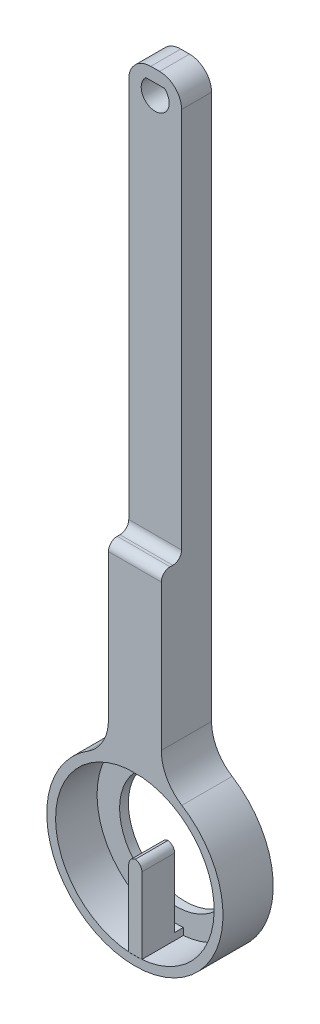
from build123d import *
from build123d.topology import SkipClean

# Parameters (mm, degrees)
BOSS_EXTRUDE1_DEPTH      = 13
BOSS_EXTRUDE1_2_DEPTH    = 13
BOSS_EXTRUDE2_DEPTH      = 13
CUT_EXTRUDE1_DEPTH       = 13
SKETCH3_W                = 6.626848164
SKETCH3_H                = 19.420298156
CUT_EXTRUDE2_DEPTH       = 13
FILLET1_R                = 10
SKETCH4_R                = 20
BOSS_EXTRUDE3_DEPTH      = 13
CUT_EXTRUDE3_DEPTH       = 13
SKETCH6_R                = 18
CUT_EXTRUDE4_DEPTH       = 24
BOSS_EXTRUDE7_DEPTH      = 22
FILLET5_R                = 1.75
FILLET6_R                = 20
SKETCH13_W               = 6.626848164
SKETCH13_H               = 84.326545424
CUT_EXTRUDE8_DEPTH       = 22
FILLET8_R                = 21.5
FILLET9_R                = 21.5
SKETCH14_W               = 17.060891399
SKETCH14_H               = 46.716771418
CUT_EXTRUDE10_DEPTH      = 22
SKETCH23_R               = 16.395826628
CUT_EXTRUDE14_DEPTH      = 4
BOSS_EXTRUDE16_DEPTH     = 2
SKETCH25_R               = 20.128500803
CUT_EXTRUDE15_DEPTH      = 9
SKETCH26_W               = 8.848519257
SKETCH26_H               = 26
CUT_EXTRUDE16_DEPTH      = 9
CUT_EXTRUDE17_DEPTH      = 9
FILLET21_R               = 3.5
SKETCH28_W               = 12
SKETCH28_H               = 42.572003563
BOSS_EXTRUDE20_DEPTH     = 15.8
BOSS_EXTRUDE21_START     = -6.8
SKETCH30_W               = 12
SKETCH30_H               = 93.599870645
BOSS_EXTRUDE21_DEPTH     = 6.8
FILLET23_R               = 5
BOSS_EXTRUDE22_DEPTH     = 6.8
CUT_EXTRUDE18_DEPTH      = 29
CUT_EXTRUDE18_DEPTH_BACK = 41
SKETCH34_W               = 5.585914081
SKETCH34_H               = 80.48337208
FILLET27_R               = 2
FILLET28_R               = 10


with BuildPart() as part:
    # Sketch1 → Boss-Extrude1 (new body)
    with BuildSketch(Plane.XY):
        with BuildLine():
            Line((4, -87.5), (-4, -87.5))
            Line((-4, -87.5), (-4, -67.904082058))
            ThreePointArc((-4, -67.904082058), (0, -107.5), (4, -67.904082058))
            Line((4, -67.904082058), (4, -87.5))
        make_face()
    extrude(amount=BOSS_EXTRUDE1_DEPTH)



with BuildPart() as body_2:
    # Sketch1 → Boss-Extrude1 2 (new body)
    with BuildSketch(Plane.XY):
        with BuildLine():
            Line((-4, 87.5), (-4, -67.904082058))
            ThreePointArc((-4, -67.904082058), (0, -67.5), (4, -67.904082058))
            Line((4, -67.904082058), (4, 87.5))
            ThreePointArc((4, 87.5), (0, 91.5), (-4, 87.5))
        make_face()
    extrude(amount=BOSS_EXTRUDE1_2_DEPTH)


with BuildPart() as part_1:
    add(part.part)

    add(body_2.part)  # Boss-Extrude2 merges body 2
    # Sketch1<3> → Boss-Extrude2 (add)
    with BuildSketch(Plane.XY):
        with BuildLine():
            Line((-4, -67.904082058), (-4, -87.5))
            Line((-4, -87.5), (4, -87.5))
            Line((4, -87.5), (4, -67.904082058))
            ThreePointArc((4, -67.904082058), (0, -67.5), (-4, -67.904082058))
        make_face()
        with BuildLine():
            Line((4, -87.5), (-4, -87.5))
            Line((-4, -87.5), (-4, -67.904082058))
            ThreePointArc((-4, -67.904082058), (-12.649110641, -102.991933385), (20, -87.5))
            ThreePointArc((20, -87.5), (15.491933385, -74.850889359), (4, -67.904082058))
            Line((4, -67.904082058), (4, -87.5))
        make_face()
    extrude(amount=BOSS_EXTRUDE2_DEPTH)

    # Sketch2 → Cut-Extrude1 (cut)
    with BuildSketch(Plane.XY.offset(13)):
        with BuildLine():
            Line((1.836704547, 90.02826846), (-1.836704547, 90.02826846))
            ThreePointArc((-1.836704547, 90.02826846), (-1.418788795, 84.715639507), (3.125, 87.5))
            ThreePointArc((3.125, 87.5), (2.784360493, 88.918788795), (1.836704547, 90.02826846))
        make_face()
    extrude(amount=-CUT_EXTRUDE1_DEPTH, mode=Mode.SUBTRACT)

    # Sketch3 → Cut-Extrude2 (cut)
    with BuildSketch(Plane(origin=(4, 0, 0), x_dir=(0, 0, -1), z_dir=(1, 0, 0))):
        with Locations((-9.686575918, 81.789850922)):
            Rectangle(SKETCH3_W, SKETCH3_H)
    extrude(amount=-CUT_EXTRUDE2_DEPTH, mode=Mode.SUBTRACT)

    # Fillet1
    # the kernel refuses this fillet: 10 mm, written as the material it adds along each edge
    with BuildSketch(Plane(origin=(4, 72.079701844, 6.373151836), x_dir=(0, 1, 0), z_dir=(-1, 0, 0))) as fillet1_piece_1:
        with BuildLine():
            CenterArc((9.413917712, -10), FILLET1_R, 90, 70.286615286)
            Line((0, -6.626848164), (-0.188278354, -6.559385127))
            ThreePointArc((-0.188278354, -6.559385127), (-0.2, -3.313424082), (-0.2, 0))
            Line((-0.2, 0), (0, 0.2))
            Line((0, 0.2), (9.413917712, 0.2))
            Line((9.413917712, 0.2), (9.413917712, 0))
        make_face()
    extrude(amount=8)

    # Sketch4 → Boss-Extrude3 (add)
    with BuildSketch(Plane.XY.offset(13)):
        with Locations(Location((0, -87.5, 0), (0, 0, 101.536959033))):
            Circle(SKETCH4_R)
    extrude(amount=BOSS_EXTRUDE3_DEPTH)

    # Sketch5 → Cut-Extrude3 (cut)
    with BuildSketch(Plane(origin=(4, 0, 0), x_dir=(0, 0, -1), z_dir=(1, 0, 0))):
        with BuildLine():
            Line((-13, 61.057159029), (-13, 87.5))
            Line((-13, 87.5), (-6.373151836, 87.5))
            ThreePointArc((-6.373151836, 87.5), (-7.529351989, 73.73795699), (-13, 61.057159029))
        make_face()
    extrude(amount=-CUT_EXTRUDE3_DEPTH, mode=Mode.SUBTRACT)

    # Sketch6 → Cut-Extrude4 (cut)
    with BuildSketch(Plane.XY.offset(26)):
        with Locations((0, -87.5)):
            Circle(SKETCH6_R)
    extrude(amount=-CUT_EXTRUDE4_DEPTH, mode=Mode.SUBTRACT)

    # Fillet6
    fillet6_edges = [part_1.edges().sort_by_distance(p)[0] for p in [
        (0, 61.057159029, 13),
    ]]
    fillet(fillet6_edges, radius=FILLET6_R)

    # Sketch13 → Cut-Extrude8 (cut)
    with BuildSketch(Plane.ZY.offset(4)):
        with Locations((9.686575918, 45.336727288)):
            Rectangle(SKETCH13_W, SKETCH13_H)
    extrude(amount=-CUT_EXTRUDE8_DEPTH, mode=Mode.SUBTRACT)

    # Fillet8
    # the kernel refuses this fillet: 21.5 mm, written as the material it adds along each edge
    with BuildSketch(Plane(origin=(-4, 3.173454576, 6.373151836), x_dir=(0, 1, 0), z_dir=(1, 0, 0))) as fillet8_piece_1:
        with BuildLine():
            CenterArc((15.525442166, 21.5), FILLET8_R, 223.770740898, 46.229259102)
            Line((0, 6.626848164), (-0.310508843, 6.329385127))
            ThreePointArc((-0.310508843, 6.329385127), (-0.43, 3.313424082), (-0.43, 0))
            Line((-0.43, 0), (0, -0.43))
            Line((0, -0.43), (15.525442166, -0.43))
            Line((15.525442166, -0.43), (15.525442166, 0))
        make_face()
    extrude(amount=8)

    # Fillet9
    fillet9_edges = [part_1.edges().sort_by_distance(p)[0] for p in [
        (0, 3.173454576, 13),
    ]]
    fillet(fillet9_edges, radius=FILLET9_R)

    # Sketch14 → Cut-Extrude10 (cut)
    with BuildSketch(Plane.ZY.offset(4)):
        with Locations((14.903597536, -4.659488967)):
            Rectangle(SKETCH14_W, SKETCH14_H)
    extrude(amount=-CUT_EXTRUDE10_DEPTH, mode=Mode.SUBTRACT)


with BuildPart() as body_2_2:
    # Sketch8 → Boss-Extrude7 (new body)
    with BuildSketch(Plane.XY.offset(2)):
        Polygon((-1.390650573, -105.446199904), (-1.390650573, -86.446199904), (1.609349427, -86.446199904), (1.609349427, -105.427911045), align=None)
    extrude(amount=BOSS_EXTRUDE7_DEPTH)

    # Fillet5
    # the kernel refuses this fillet: 1.75 mm, written as the material it takes off along each edge
    with BuildSketch(Plane(origin=(1.609349427, -86.446199904, -2.375), x_dir=(-1, 0, 0), z_dir=(0, 0, 1)), Plane(origin=(-1.390650573, -86.446199904, -2.375), x_dir=(0, -1, 0), z_dir=(0, 0, 1))) as fillet5_piece_1:
        with BuildLine():
            CenterArc((FILLET5_R, FILLET5_R), FILLET5_R, 180, 90)
            Line((0, FILLET5_R), (0, 0))
            Line((0, 0), (FILLET5_R, 0))
        make_face()
    extrude(amount=30.75, mode=Mode.SUBTRACT)


with BuildPart() as cut_extrude14_tool:
    # Sketch23 → Cut-Extrude14 (new body)
    with BuildSketch(Plane(origin=(0, 0, 0), x_dir=(-1, 0, 0), z_dir=(0, 0, -1))):
        with Locations((0, -87.5)):
            Circle(SKETCH23_R)
    extrude(amount=-CUT_EXTRUDE14_DEPTH)


with BuildPart() as part_2:
    add(part_1.part)

    # Cut-Extrude14: cut by cut_extrude14_tool
    add(cut_extrude14_tool.part, mode=Mode.SUBTRACT)

    # Sketch24 → Boss-Extrude16 (add)
    with BuildSketch(Plane(origin=(0, 0, 0), x_dir=(-1, 0, 0), z_dir=(0, 0, -1))):
        with BuildLine():
            ThreePointArc((0, -71.104173372), (-16.395826628, -87.5), (0, -103.895826628))
            ThreePointArc((0, -103.895826628), (16.395826628, -87.5), (0, -71.104173372))
        make_face()
        with BuildLine():
            ThreePointArc((0, -74.744099259), (12.884401545, -87.628500803), (0, -100.512902348))
            ThreePointArc((0, -100.512902348), (-12.884401545, -87.628500803), (0, -74.744099259))
        make_face(mode=Mode.SUBTRACT)
    extrude(amount=-BOSS_EXTRUDE16_DEPTH)


with BuildPart() as body_2_2_1:
    add(body_2_2.part)

    # Cut-Extrude14: cut by cut_extrude14_tool
    add(cut_extrude14_tool.part, mode=Mode.SUBTRACT)


with BuildPart() as cut_extrude15_tool:
    # Sketch25 → Cut-Extrude15 (new body)
    with BuildSketch(Plane.XY.offset(26)):
        with Locations((0, -87.628500803)):
            Circle(SKETCH25_R)
    extrude(amount=-CUT_EXTRUDE15_DEPTH)


with BuildPart() as part_3:
    add(part_2.part)

    # Cut-Extrude15: cut by cut_extrude15_tool
    add(cut_extrude15_tool.part, mode=Mode.SUBTRACT)

    # Sketch26 → Cut-Extrude16 (cut)
    with BuildSketch(Plane.XY.offset(6.373151836)):
        with Locations((0.424259629, 79.373396417)):
            Rectangle(SKETCH26_W, SKETCH26_H)
    extrude(amount=-CUT_EXTRUDE16_DEPTH, mode=Mode.SUBTRACT)

    # Sketch27 → Cut-Extrude17 (cut)
    with BuildSketch(Plane.XY.offset(6.373151836)):
        with BuildLine():
            Line((2.132304127, 63.840504789), (-2.132304127, 63.840504789))
            ThreePointArc((-2.132304127, 63.840504789), (-1.329315567, 58.476984755), (3.22736468, 61.417869469))
            ThreePointArc((3.22736468, 61.417869469), (2.940884714, 62.747185037), (2.132304127, 63.840504789))
        make_face()
    extrude(amount=-CUT_EXTRUDE17_DEPTH, mode=Mode.SUBTRACT)

    # Fillet21
    fillet21_edges = [part_3.edges().sort_by_distance(p)[0] for p in [
        (4, 66.373396417, 3.186575918),
        (-4, 66.373396417, 3.186575918),
    ]]
    fillet(fillet21_edges, radius=FILLET21_R)

    # Sketch28 → Boss-Extrude20 (add)
    with BuildSketch(Plane(origin=(0, 0, 0), x_dir=(-1, 0, 0), z_dir=(0, 0, -1))):
        with Locations((0, -48.302629702)):
            Rectangle(SKETCH28_W, SKETCH28_H)
    extrude(amount=-BOSS_EXTRUDE20_DEPTH)

    # Sketch30 → Boss-Extrude21 (add)
    with SkipClean():  # the faces are left unmerged after this step: merging them gives an invalid solid
        with BuildSketch(Plane(origin=(0, 0, 0), x_dir=(-1, 0, 0), z_dir=(0, 0, -1)).offset(BOSS_EXTRUDE21_START)):
            with Locations((0, 19.783307403)):
                Rectangle(SKETCH30_W, SKETCH30_H)
            with BuildLine():
                Line((2.132304127, 63.840504789), (-2.132304127, 63.840504789))
                ThreePointArc((-2.132304127, 63.840504789), (0, 58.190504789), (2.132304127, 63.840504789))
            make_face(mode=Mode.SUBTRACT)
        extrude(amount=BOSS_EXTRUDE21_DEPTH)

    # Fillet23
    fillet23_edges = [part_3.edges().sort_by_distance(p)[0] for p in [
        (6, 66.583242725, 3.4),
        (-6, 66.583242725, 3.4),
    ]]
    fillet(fillet23_edges, radius=FILLET23_R)

    # Sketch33 → Boss-Extrude22 (add)
    with BuildSketch(Plane.XY.offset(6.8)):
        with BuildLine():
            Line((-2.132304127, 63.840504789), (2.132304127, 63.840504789))
            ThreePointArc((2.132304127, 63.840504789), (0, 58.190504789), (-2.132304127, 63.840504789))
        make_face()
        with BuildLine():
            Line((-2.09926937, 63.802972072), (2.09926937, 63.802972072))
            ThreePointArc((2.09926937, 63.802972072), (0, 58.240504789), (-2.09926937, 63.802972072))
        make_face(mode=Mode.SUBTRACT)
    extrude(amount=-BOSS_EXTRUDE22_DEPTH)


with BuildPart() as body_2_2_2:
    add(body_2_2_1.part)

    # Cut-Extrude15: cut by cut_extrude15_tool
    add(cut_extrude15_tool.part, mode=Mode.SUBTRACT)


with BuildPart() as cut_extrude18_tool:
    # Sketch34 → Cut-Extrude18 (new, two sides: drawn at the far end of the back side and taken through both)
    with BuildSketch(Plane.ZY.offset(6).offset(-CUT_EXTRUDE18_DEPTH_BACK)):
        with Locations((14.20704296, -67.25831396)):
            Rectangle(SKETCH34_W, SKETCH34_H)
    extrude(amount=CUT_EXTRUDE18_DEPTH + CUT_EXTRUDE18_DEPTH_BACK)


with BuildPart() as part_4:
    add(part_3.part)

    # Cut-Extrude18: cut by cut_extrude18_tool
    add(cut_extrude18_tool.part, mode=Mode.SUBTRACT)

    # Fillet27
    fillet27_edges = [part_4.edges().sort_by_distance(p)[0] for p in [
        (0, -27.01662792, 6.8),
        (0, -27.01662792, 11.414085919),
    ]]
    fillet(fillet27_edges, radius=FILLET27_R)

    # Fillet28
    fillet28_edges = [part_4.edges().sort_by_distance(p)[0] for p in [
        (6, -68.421215972, 5.707042959),
        (-6, -68.421215972, 5.707042959),
    ]]
    fillet(fillet28_edges, radius=FILLET28_R)


with BuildPart() as body_2_2_3:
    add(body_2_2_2.part)

    # Cut-Extrude18: cut by cut_extrude18_tool
    add(cut_extrude18_tool.part, mode=Mode.SUBTRACT)


solid = Compound([part_4.part, body_2_2_3.part])
